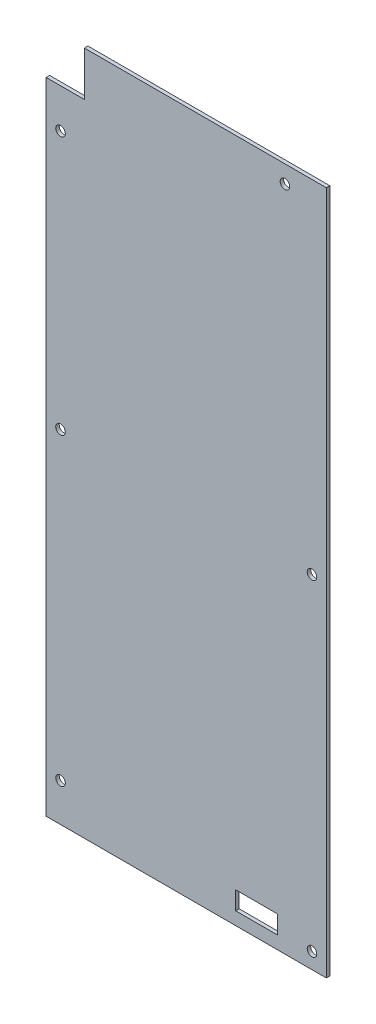
from build123d import *

# Parameters (mm, degrees)
SKETCH3_W              = 88
SKETCH3_H              = 215
BOSS_EXTRUDE3_DEPTH    = 1.1
CUT_EXTRUDE1_OUTLINE_W = 12
CUT_EXTRUDE1_OUTLINE_H = 13.99905087
CUT_EXTRUDE1_OUTLINE_R = 1.5
CUT_EXTRUDE1_DEPTH     = 1.1
SKETCH5_W              = 13.1
SKETCH5_H              = 5.72
CUT_EXTRUDE3_DEPTH     = 1.1


# Read off the part's stored shape, not the designer's step: Cut-Extrude1
with BuildPart() as part:
    # Sketch3 → Boss-Extrude3 (new body)
    with BuildSketch(Plane.XY):
        with Locations((0.594511969, -70.924817192)):
            Rectangle(SKETCH3_W, SKETCH3_H)
    extrude(amount=BOSS_EXTRUDE3_DEPTH)

    # Cut-Extrude1 outline → Cut-Extrude1 (cut)
    with BuildSketch(Plane.XY):
        with Locations((-37.405488031, 29.575657373)):
            Rectangle(CUT_EXTRUDE1_OUTLINE_W, CUT_EXTRUDE1_OUTLINE_H)
        with Locations((31.594511969, 31.075182808)):
            Circle(CUT_EXTRUDE1_OUTLINE_R)
        with Locations((-38.905488031, -166.424817192)):
            Circle(CUT_EXTRUDE1_OUTLINE_R)
        with Locations((-38.905488031, -70.924817192)):
            Circle(CUT_EXTRUDE1_OUTLINE_R)
        with Locations((-38.905488031, 10.255182808)):
            Circle(CUT_EXTRUDE1_OUTLINE_R)
        with Locations((40.094511969, -70.924817192)):
            Circle(CUT_EXTRUDE1_OUTLINE_R)
        with Locations((40.094511969, -173.424817192)):
            Circle(CUT_EXTRUDE1_OUTLINE_R)
    extrude(amount=CUT_EXTRUDE1_DEPTH, mode=Mode.SUBTRACT)

    # Sketch5 → Cut-Extrude3 (cut)
    with BuildSketch(Plane.XY.offset(1.1)):
        with Locations((22.654511969, -171.524817192)):
            Rectangle(SKETCH5_W, SKETCH5_H)
    extrude(amount=-CUT_EXTRUDE3_DEPTH, mode=Mode.SUBTRACT)


solid = part.part
